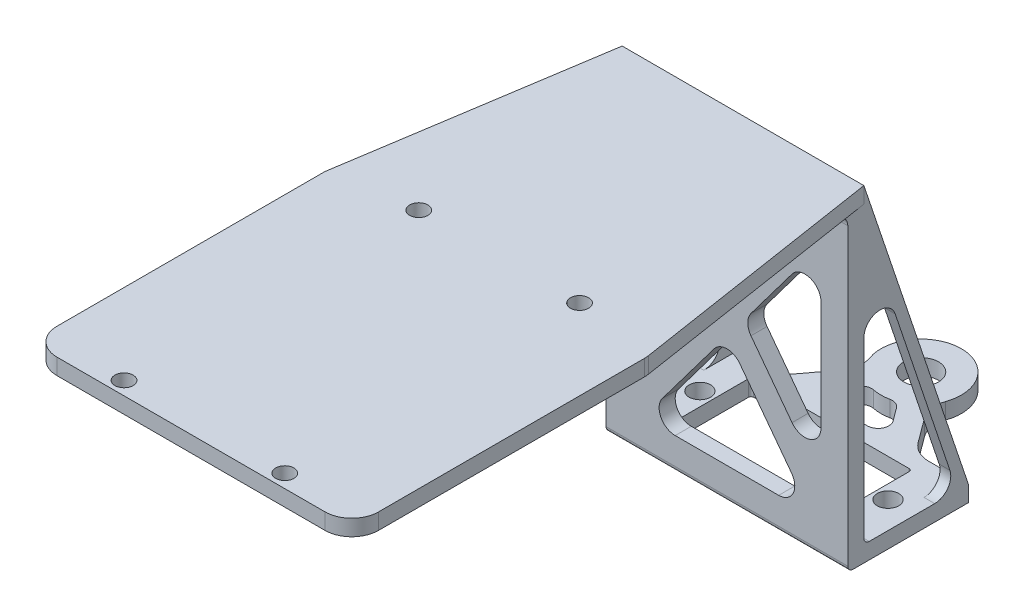
from build123d import *

# Parameters (mm, degrees)
SKETCH1_R           = 2
SKETCH1_W           = 30
SKETCH1_H           = 14
BOSS_EXTRUDE1_DEPTH = 3
CUT_EXTRUDE1_DEPTH  = 3
FILLET1_R           = 5
FILLET2_R           = 2
SKETCH3_W           = 45.1
SKETCH3_H           = 3
BOSS_EXTRUDE2_DEPTH = 58
FILLET3_R           = 0.5
FILLET4_R           = 1
CUT_EXTRUDE2_DEPTH  = 10
FILLET5_R           = 3
BOSS_EXTRUDE3_DEPTH = 2
FILLET6_R           = 3
SKETCH6_W           = 45.1
SKETCH6_H           = 3
BOSS_EXTRUDE4_DEPTH = 45
FILLET8_R           = 2
SKETCH7_R           = 1.7
CUT_EXTRUDE3_DEPTH  = 10
BOSS_EXTRUDE5_DEPTH = 3
SKETCH10_R          = 1.7
BOSS_EXTRUDE6_DEPTH = 3
FILLET12_R          = 5


with BuildPart() as part:
    # Sketch1 → Boss-Extrude1 (new body)
    with BuildSketch(Plane(origin=(0, 0, 0), x_dir=(1, 0, 0), z_dir=(0, 1, 0))):
        Polygon((0, 10), (-22.55, 10), (-22.55, -36.239750654), (22.55, -36.239750654), (22.55, 10), align=None)
        with Locations(Location((-17.55, -23.739750654, 0), (0, 0, 270))):
            Circle(SKETCH1_R, mode=Mode.SUBTRACT)
        with Locations((0, -23.739750654)):
            Rectangle(SKETCH1_W, SKETCH1_H, mode=Mode.SUBTRACT)
        with BuildLine():
            ThreePointArc((-3.218514532, -0.451291712), (-2.452467947, 2.132580824), (0, 3.25))
            ThreePointArc((0, 3.25), (2.132580824, 2.452467947), (3.218514532, 0.451291712))
            ThreePointArc((3.218514532, 0.451291712), (2.452467947, -2.132580824), (0, -3.25))
            ThreePointArc((0, -3.25), (-2.132580824, -2.452467947), (-3.218514532, -0.451291712))
        make_face(mode=Mode.SUBTRACT)
        with Locations(Location((17.55, -23.739750654, 0), (0, 0, 270))):
            Circle(SKETCH1_R, mode=Mode.SUBTRACT)
    extrude(amount=BOSS_EXTRUDE1_DEPTH)

    # Sketch2 → Cut-Extrude1 (cut)
    with BuildSketch(Plane(origin=(0, 3, 0), x_dir=(1, 0, 0), z_dir=(0, 1, 0))):
        with BuildLine():
            Line((-22.55, 10), (-22.55, -13.739750654))
            Line((-22.55, -13.739750654), (-12.644514973, -13.739750654))
            Line((-12.644514973, -13.739750654), (-5.905264771, -4.623618495))
            ThreePointArc((-5.905264771, -4.623618495), (-2.445456421, 7.090115859), (7.5, 0))
            ThreePointArc((7.5, 0), (7.090115859, -2.445456421), (5.905264771, -4.623618495))
            Line((5.905264771, -4.623618495), (12.644514973, -13.739750654))
            Line((12.644514973, -13.739750654), (22.55, -13.739750654))
            Line((22.55, -13.739750654), (22.55, 10))
            Line((22.55, 10), (-22.55, 10))
        make_face()
        with BuildLine():
            Line((-7.670157029, -13.739750654), (7.670157029, -13.739750654))
            Line((7.670157029, -13.739750654), (2.68876926, -7.001465551))
            ThreePointArc((2.68876926, -7.001465551), (0, -7.5), (-2.68876926, -7.001465551))
            Line((-2.68876926, -7.001465551), (-7.670157029, -13.739750654))
        make_face()
    extrude(amount=-CUT_EXTRUDE1_DEPTH, mode=Mode.SUBTRACT)

    # Fillet1
    fillet1_edges = [part.edges().sort_by_distance(p)[0] for p in [
        (5.905264771, 1.5, 4.623618495),
        (-5.905264771, 1.5, 4.623618495),
        (-12.644514973, 1.5, 13.739750654),
        (12.644514973, 1.5, 13.739750654),
    ]]
    fillet(fillet1_edges, radius=FILLET1_R)

    # Fillet2
    fillet2_edges = [part.edges().sort_by_distance(p)[0] for p in [
        (-2.68876926, 1.5, 7.001465551),
        (2.68876926, 1.5, 7.001465551),
        (7.670157029, 1.5, 13.739750654),
        (-7.670157029, 1.5, 13.739750654),
    ]]
    fillet(fillet2_edges, radius=FILLET2_R)

    # Sketch3 → Boss-Extrude2 (add)
    with BuildSketch(Plane(origin=(0, 3, 0), x_dir=(1, 0, 0), z_dir=(0, 1, 0))):
        with Locations((0, -34.739750654)):
            Rectangle(SKETCH3_W, SKETCH3_H)
    extrude(amount=BOSS_EXTRUDE2_DEPTH)

    # Fillet3
    fillet3_edges = [part.edges().sort_by_distance(p)[0] for p in [
        (15, 1.5, 16.739750654),
        (-15, 1.5, 16.739750654),
        (-15, 1.5, 30.739750654),
        (15, 1.5, 30.739750654),
    ]]
    fillet(fillet3_edges, radius=FILLET3_R)

    # Fillet4
    fillet4_edges = [part.edges().sort_by_distance(p)[0] for p in [
        (0, 3, 33.239750654),
        (0, 0, 36.239750654),
    ]]
    fillet(fillet4_edges, radius=FILLET4_R)

    # Sketch4 → Cut-Extrude2 (cut)
    with BuildSketch(Plane.XY.offset(36.239750654)):
        Polygon((-3.127501776, 31), (-17.55, 50.187359056), (-17.55, 11.812640944), align=None)
        Polygon((15.66416489, 56), (-15.66416489, 56), (0, 35.160756243), align=None)
        Polygon((17.55, 11.812640944), (17.55, 50.187359056), (3.127501776, 31), align=None)
        Polygon((15.66416489, 6), (0, 26.839243757), (-15.66416489, 6), align=None)
    extrude(amount=-CUT_EXTRUDE2_DEPTH, mode=Mode.SUBTRACT)

    # Fillet5
    fillet5_edges = [part.edges().sort_by_distance(p)[0] for p in [
        (3.127501776, 31, 34.739750654),
        (17.55, 50.187359056, 34.739750654),
        (17.55, 11.812640944, 34.739750654),
        (-15.66416489, 56, 34.739750654),
        (15.66416489, 56, 34.739750654),
        (0, 35.160756243, 34.739750654),
        (0, 26.839243757, 34.739750654),
        (15.66416489, 6, 34.739750654),
        (-15.66416489, 6, 34.739750654),
        (-17.55, 50.187359056, 34.739750654),
        (-3.127501776, 31, 34.739750654),
        (-17.55, 11.812640944, 34.739750654),
    ]]
    fillet(fillet5_edges, radius=FILLET5_R)

    # Sketch5 → Boss-Extrude3 (add)
    with BuildSketch(Plane(origin=(22.55, 0, 0), x_dir=(0, 0, -1), z_dir=(1, 0, 0))):
        Polygon((-33.239750654, 61), (-13.739750654, 3), (-15.849760206, 3), (-33.239750654, 54.724074153), align=None)
    boss_extrude3 = extrude(amount=-BOSS_EXTRUDE3_DEPTH)

    # Mirror1: Boss-Extrude3 across plane
    add(boss_extrude3.mirror(Plane.ZY))

    # Fillet6
    fillet6_edges = [part.edges().sort_by_distance(p)[0] for p in [
        (21.55, 54.724074153, 33.239750654),
        (21.55, 3, 15.849760206),
        (-21.55, 54.724074153, 33.239750654),
        (-21.55, 3, 15.849760206),
    ]]
    fillet(fillet6_edges, radius=FILLET6_R)

    # Sketch6 → Boss-Extrude4 (add)
    with BuildSketch(Plane.XY.offset(36.239750654)):
        with Locations((0, 59.5)):
            Rectangle(SKETCH6_W, SKETCH6_H)
    extrude(amount=BOSS_EXTRUDE4_DEPTH)

    # Fillet8
    fillet8_edges = [part.edges().sort_by_distance(p)[0] for p in [
        (0, 58, 36.239750654),
    ]]
    fillet(fillet8_edges, radius=FILLET8_R - 0.0001)  # a hair under: the kernel refuses the full size

    # Sketch7 → Cut-Extrude3 (cut)
    with BuildSketch(Plane.XZ.offset(-58)):
        with Locations(Location((-15, 78.739750654, 0), (0, 0, 270))):
            Circle(SKETCH7_R)
        with Locations(Location((15, 78.739750654, 0), (0, 0, 270))):
            Circle(SKETCH7_R)
    extrude(amount=-CUT_EXTRUDE3_DEPTH, mode=Mode.SUBTRACT)

    # Sketch9 → Boss-Extrude5 (add)
    with BuildSketch(Plane(origin=(0, 61, 0), x_dir=(1, 0, 0), z_dir=(0, 1, 0))):
        Polygon((-22.55, -81.239750654), (-22.55, -33.239750654), (-30, -81.239750654), align=None)
        Polygon((-22.55, -81.239750654), (-30, -81.239750654), (-30, -131.239750654), (0, -131.239750654), (0, -81.239750654), align=None)
        Polygon((22.55, -81.239750654), (0, -81.239750654), (0, -131.239750654), (30, -131.239750654), (30, -81.239750654), align=None)
        Polygon((22.55, -33.239750654), (22.55, -81.239750654), (30, -81.239750654), align=None)
    extrude(amount=-BOSS_EXTRUDE5_DEPTH)

    # Sketch10 → Boss-Extrude6 (add)
    with BuildSketch(Plane.XZ.offset(-58)):
        Polygon((-30, 136.239750654), (-30, 131.239750654), (30, 131.239750654), (30, 136.239750654), (10.586303141, 136.239750654), (7.586303141, 136.239750654), (-21.497160634, 136.239750654), (-24.497160634, 136.239750654), align=None)
        with Locations(Location((-15, 133.739750654, 0), (0, 0, 270))):
            Circle(SKETCH10_R, mode=Mode.SUBTRACT)
        with BuildLine():
            ThreePointArc((16.7, 133.739750654), (15, 132.039750654), (13.3, 133.739750654))
            ThreePointArc((13.3, 133.739750654), (15, 135.439750654), (16.7, 133.739750654))
        make_face(mode=Mode.SUBTRACT)
    extrude(amount=-BOSS_EXTRUDE6_DEPTH)

    # Fillet12
    fillet12_edges = [part.edges().sort_by_distance(p)[0] for p in [
        (-30, 59.5, 81.239750654),
        (30, 59.5, 81.239750654),
        (-30, 59.5, 136.239750654),
        (30, 59.5, 136.239750654),
    ]]
    fillet(fillet12_edges, radius=FILLET12_R)


solid = part.part
